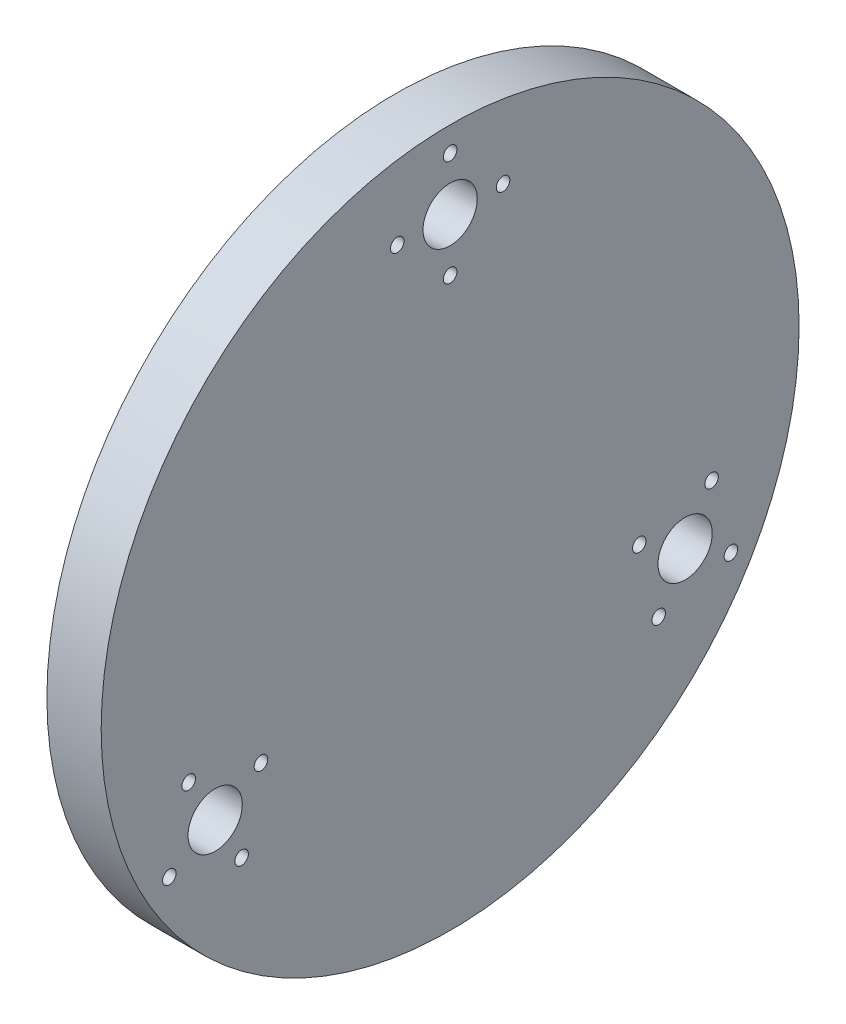
from build123d import *

# Parameters (mm, degrees)
SKETCH1_R           = 64.308589671
SKETCH1_R_2         = 1.25
SKETCH1_R_3         = 5
BOSS_EXTRUDE2_DEPTH = 10


with BuildPart() as part:
    # Sketch1 → Boss-Extrude2 (new body)
    with BuildSketch(Plane(origin=(0, 0, 0), x_dir=(0, 0, -1), z_dir=(1, 0, 0))):
        Circle(SKETCH1_R)
        with Locations((51.745017876, -29.875)):
            Circle(SKETCH1_R_2, mode=Mode.SUBTRACT)
        with Locations((0, 50)):
            Circle(SKETCH1_R_3, mode=Mode.SUBTRACT)
        with Locations((48.176270189, -16.556252313)):
            Circle(SKETCH1_R_2, mode=Mode.SUBTRACT)
        with Locations((43.301270189, -25)):
            Circle(SKETCH1_R_3, mode=Mode.SUBTRACT)
        with Locations((0, 59.75)):
            Circle(SKETCH1_R_2, mode=Mode.SUBTRACT)
        with Locations((9.75, 50)):
            Circle(SKETCH1_R_2, mode=Mode.SUBTRACT)
        with Locations((0, 40.25)):
            Circle(SKETCH1_R_2, mode=Mode.SUBTRACT)
        with Locations((-9.75, 50)):
            Circle(SKETCH1_R_2, mode=Mode.SUBTRACT)
        with Locations((38.426270189, -33.443747687)):
            Circle(SKETCH1_R_2, mode=Mode.SUBTRACT)
        with Locations((34.857522502, -20.125)):
            Circle(SKETCH1_R_2, mode=Mode.SUBTRACT)
        with Locations((-51.745017876, -29.875)):
            Circle(SKETCH1_R_2, mode=Mode.SUBTRACT)
        with Locations((-38.426270189, -33.443747687)):
            Circle(SKETCH1_R_2, mode=Mode.SUBTRACT)
        with Locations((-43.301270189, -25)):
            Circle(SKETCH1_R_3, mode=Mode.SUBTRACT)
        with Locations((-48.176270189, -16.556252313)):
            Circle(SKETCH1_R_2, mode=Mode.SUBTRACT)
        with Locations((-34.857522502, -20.125)):
            Circle(SKETCH1_R_2, mode=Mode.SUBTRACT)
    extrude(amount=BOSS_EXTRUDE2_DEPTH)


solid = part.part
